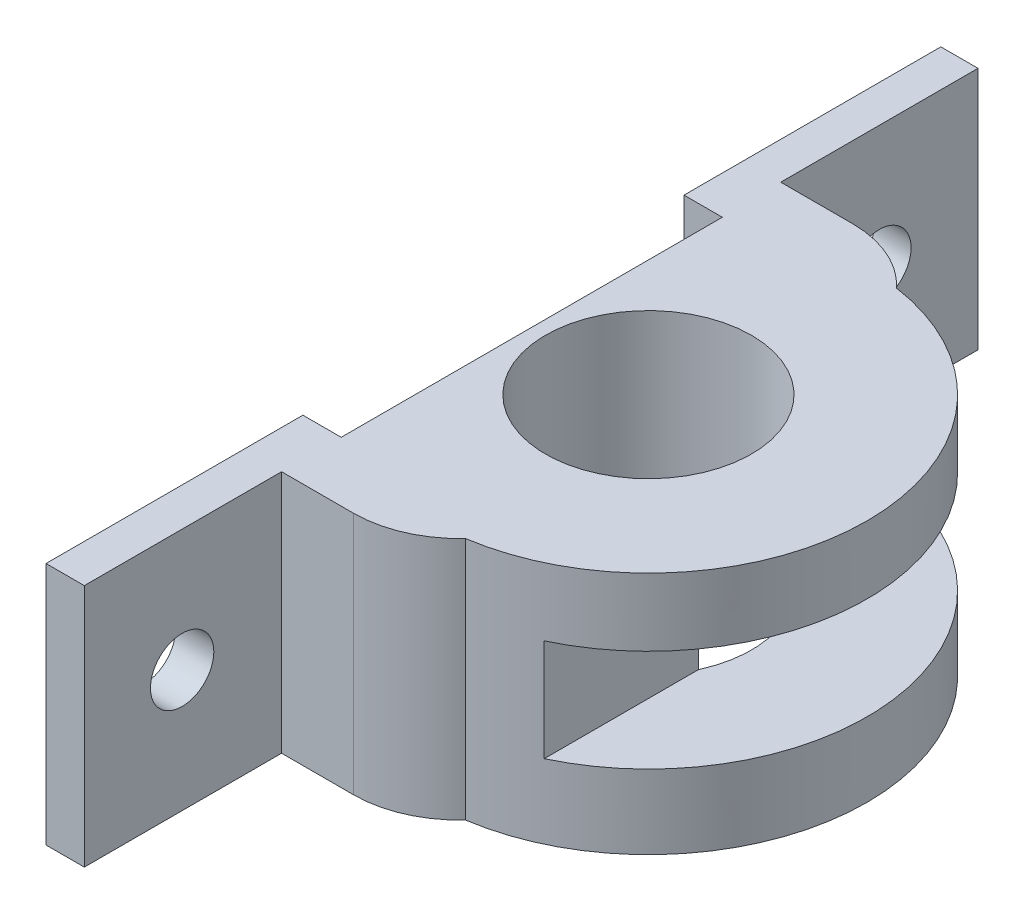
from build123d import *

# Parameters (mm, degrees)
SKETCH_1_R           = 20.68
SKETCH_1_R_2         = 9.68
EXTRUDE_1_DEPTH      = 116.68
SKETCH_11_W          = 27
SKETCH_11_H          = 150
CUT_EXTRUDE_3_DEPTH  = 40
SKETCH_13_W          = 10
SKETCH_13_H          = 128.345013401
CUT_EXTRUDE_7_DEPTH  = 126.614916312
SKETCH_15_W          = 8
SKETCH_15_H          = 68.68
CUT_EXTRUDE_9_DEPTH  = 48
SKETCH_16_W          = 15.549431524
SKETCH_16_H          = 20
SKETCH_16_W_2        = 15.459431524
EXTRUDE_4_DEPTH      = 19.2
SKETCH_17_W          = 19.20851187
SKETCH_17_H          = 14.03
CUT_EXTRUDE_10_DEPTH = 20.2
SKETCH_18_R          = 9.59
CUT_EXTRUDE_11_DEPTH = 121.289430957
SKETCH_21_R          = 2.985
CUT_EXTRUDE_12_DEPTH = 55.2
EXTRUDE_START        = 55.2
SKETCH_24_R          = 20.59
SKETCH_24_R_2        = 9.59
EXTRUDE_2_DEPTH      = 55.2
CUT_EXTRUDE_13_DEPTH = 55.2
SKETCH_26_W          = 10.00851187
SKETCH_26_H          = 41.68
CUT_EXTRUDE_15_DEPTH = 55.2
SKETCH_27_W          = 10
SKETCH_27_H          = 40
CUT_EXTRUDE_16_DEPTH = 55.2
SKETCH_28_W          = 44.880694938
SKETCH_28_H          = 9.608044066
CUT_EXTRUDE_17_DEPTH = 12.2
SKETCH_35_W          = 13.53
SKETCH_35_H          = 20
EXTRUDE_10_DEPTH     = 15
EXTRUDE_11_DEPTH     = 15
SKETCH_37_W          = 9
SKETCH_37_H          = 20
EXTRUDE_12_DEPTH     = 20
SKETCH_38_W          = 9
SKETCH_38_H          = 20
EXTRUDE_13_DEPTH     = 20
SKETCH_42_R          = 2.985
CUT_EXTRUDE_21_DEPTH = 20
CUT_EXTRUDE_23_DEPTH = 138.235841092
SKETCH_45_W          = 3
SKETCH_45_H          = 20
EXTRUDE_14_DEPTH     = 30
SKETCH_46_W          = 3
SKETCH_46_H          = 20
EXTRUDE_15_DEPTH     = 30
SKETCH_47_W          = 33.078221107
SKETCH_47_H          = 20
EXTRUDE_16_DEPTH     = 50
SKETCH_48_W          = 30
SKETCH_48_H          = 20
EXTRUDE_17_DEPTH     = 50
SKETCH_50_W          = 50
SKETCH_50_H          = 20
EXTRUDE_18_DEPTH     = 1
SKETCH_51_W          = 50
SKETCH_51_H          = 20
EXTRUDE_19_DEPTH     = 1
SKETCH_52_W          = 53
SKETCH_52_H          = 14
CUT_EXTRUDE_24_DEPTH = 151.972575738
SKETCH_53_W          = 53
SKETCH_53_H          = 14
CUT_EXTRUDE_25_DEPTH = 151.942387436
SKETCH_54_W          = 40
SKETCH_54_H          = 73.27
CUT_EXTRUDE_26_DEPTH = 147.866192927
SKETCH_56_W          = 13.00851187
SKETCH_56_H          = 20
EXTRUDE_21_DEPTH     = 3.08
SKETCH_60_W          = 6.504255935
SKETCH_60_H          = 76.35
CUT_EXTRUDE_30_DEPTH = 137.106994034
CUT_EXTRUDE_32_DEPTH = 20
SKETCH_64_W          = 16.20851187
SKETCH_64_H          = 0.09
EXTRUDE_22_DEPTH     = 20
SKETCH_65_W          = 3.495744065
SKETCH_65_H          = 3.26
CUT_EXTRUDE_33_DEPTH = 137.057988464
SKETCH_66_W          = 3.495744065
SKETCH_66_H          = 1.776778893
SKETCH_66_W_2        = 3.503635083
SKETCH_66_H_2        = 1.775
EXTRUDE_23_DEPTH     = 20.2
SKETCH_68_W          = 6.504255935
SKETCH_68_H          = 3.66
CUT_EXTRUDE_34_DEPTH = 20
SKETCH_69_R          = 2.985
CUT_EXTRUDE_35_DEPTH = 126.598983893
SKETCH_70_R          = 2.985
CUT_EXTRUDE_36_DEPTH = 132.360728238
SKETCH_71_W          = 38.005321573
SKETCH_71_H          = 111.965885132
CUT_EXTRUDE_37_DEPTH = 147.475577566
SKETCH_72_R          = 9.7
CUT_EXTRUDE_38_DEPTH = 38.185254838
CUT_EXTRUDE_START    = -22
SKETCH_77_R          = 30.59
SKETCH_77_R_2        = 20.59
CUT_EXTRUDE_2_DEPTH  = 22
SKETCH_78_W          = 34.816185151
SKETCH_78_H          = 22.96559116
EXTRUDE_26_DEPTH     = 0.1
SKETCH_80_W          = 2.900031179
SKETCH_80_H          = 6.148706656
EXTRUDE_28_DEPTH     = 23.1
SKETCH_81_W          = 6.148706656
SKETCH_81_H          = 23.1
EXTRUDE_29_DEPTH     = 14.1
SKETCH_82_W          = 6.148706656
SKETCH_82_H          = 0.13440884
CUT_EXTRUDE_39_DEPTH = 19.1
SKETCH_83_W          = 2.900031179
SKETCH_83_H          = 22.96559116
EXTRUDE_30_DEPTH     = 19.1
FILLET_1_R           = 10
SKETCH_84_W          = 3.5
SKETCH_84_H          = 19.1
EXTRUDE_31_DEPTH     = 23.1
SKETCH_85_W          = 3.5
SKETCH_85_H          = 0.52
CUT_EXTRUDE_40_DEPTH = 48.860163141
SKETCH_86_W          = 3.5
SKETCH_86_H          = 22.96559116
EXTRUDE_32_DEPTH     = 62.1
SKETCH_87_W          = 3.60851187
SKETCH_87_H          = 34.816185151
CUT_EXTRUDE_41_DEPTH = 62.1
SKETCH_89_W          = 0.10851187
SKETCH_89_H          = 6.15
EXTRUDE_33_DEPTH     = 23.1
EXTRUDE_34_DEPTH     = 22.1
SKETCH_91_W          = 0.971561636
SKETCH_91_H          = 22.96559116
CUT_EXTRUDE_42_DEPTH = 22.1
SKETCH_95_W          = 6.15
SKETCH_95_H          = 22.96559116
EXTRUDE_35_DEPTH     = 14.1
FILLET_2_R           = 10
SKETCH_96_W          = 3.60851187
SKETCH_96_H          = 2.548438364
CUT_EXTRUDE_43_DEPTH = 55.35700885
SKETCH_97_W          = 3.5
SKETCH_97_H          = 6.148706656
EXTRUDE_36_DEPTH     = 23.1
CUT_EXTRUDE_44_DEPTH = 23.1
SKETCH_99_W          = 6.15
SKETCH_99_H          = 0.13440884
CUT_EXTRUDE_45_DEPTH = 23.1
SKETCH_101_R         = 2.985
CUT_EXTRUDE_46_DEPTH = 23.1
SKETCH_103_W         = 3.60851187
SKETCH_103_H         = 0.54
CUT_EXTRUDE_49_DEPTH = 53.222714265
SKETCH_104_W         = 3.60851187
SKETCH_104_H         = 0.54
CUT_EXTRUDE_50_DEPTH = 53.222714265


with BuildPart() as part:
    # 草圖1 → 伸長-薄件1 (new body)
    with BuildSketch(Plane(origin=(0, 0, 0), x_dir=(1, 0, 0), z_dir=(0, 1, 0))):
        Circle(SKETCH_1_R)
        Circle(SKETCH_1_R_2, mode=Mode.SUBTRACT)
    extrude(amount=EXTRUDE_1_DEPTH)

    # 草圖11 → 除料-伸長3 (cut)
    with BuildSketch(Plane(origin=(0, 116.68, 0), x_dir=(1, 0, 0), z_dir=(0, 1, 0))):
        with Locations((21.70851187, -44.235815192)):
            Rectangle(SKETCH_11_W, SKETCH_11_H)
    extrude(amount=-CUT_EXTRUDE_3_DEPTH, mode=Mode.SUBTRACT)

    # 草圖13 → 除料-伸長7 (cut, through all)
    with BuildSketch(Plane.XY.offset(21)):
        with Locations((-16, 58.612182466)):
            Rectangle(SKETCH_13_W, SKETCH_13_H)
    extrude(amount=-CUT_EXTRUDE_7_DEPTH, mode=Mode.SUBTRACT)

    # 草圖15 → 除料-伸長9 (cut)
    with BuildSketch(Plane.XY.offset(21)):
        with Locations((-1.395744065, 52.34)):
            Rectangle(SKETCH_15_W, SKETCH_15_H)
    extrude(amount=-CUT_EXTRUDE_9_DEPTH, mode=Mode.SUBTRACT)

    # 草圖16 → 填料-伸長4 (add)
    with BuildSketch(Plane(origin=(8.20851187, 0, 0), x_dir=(0, 0, -1), z_dir=(1, 0, 0))):
        with Locations((12.905284238, 106.68)):
            Rectangle(SKETCH_16_W, SKETCH_16_H)
        with Locations((-12.860284238, 106.68)):
            Rectangle(SKETCH_16_W_2, SKETCH_16_H)
    extrude(amount=-EXTRUDE_4_DEPTH)

    # 草圖17 → 除料-伸長10 (cut)
    with BuildSketch(Plane(origin=(0, 116.68, 0), x_dir=(1, 0, 0), z_dir=(0, 1, 0))):
        with Locations((-1.395744065, -0.045)):
            Rectangle(SKETCH_17_W, SKETCH_17_H)
    extrude(amount=-CUT_EXTRUDE_10_DEPTH, mode=Mode.SUBTRACT)

    # 草圖18 → 除料-伸長11 (cut, through all)
    with BuildSketch(Plane.XZ):
        with Locations(Location((0, 0, 0), (0, 0, 90))):
            Circle(SKETCH_18_R)
    extrude(amount=-CUT_EXTRUDE_11_DEPTH, mode=Mode.SUBTRACT)

    # 草圖21 → 除料-伸長12 (cut)
    with BuildSketch(Plane(origin=(0, 0, -20.68), x_dir=(-1, 0, 0), z_dir=(0, 0, -1))):
        with Locations((1.39148813, 108.73)):
            Circle(SKETCH_21_R)
    extrude(amount=-CUT_EXTRUDE_12_DEPTH, mode=Mode.SUBTRACT)

    # 草圖24 → 伸長-薄件2 (add)
    with BuildSketch(Plane.XZ.offset(EXTRUDE_START)):
        Circle(SKETCH_24_R)
        Circle(SKETCH_24_R_2, mode=Mode.SUBTRACT)
    extrude(amount=-EXTRUDE_2_DEPTH)

    # 草圖25 → 除料-伸長13 (cut)
    with BuildSketch(Plane.XY.offset(21)):
        Polygon((-1.39148813, -11.785), (22.612379708, -11.785), (22.612379708, -63.873337429), (-22.749525245, -63.873337429), (-22.749525245, -11.785), align=None)
    extrude(amount=-CUT_EXTRUDE_13_DEPTH, mode=Mode.SUBTRACT)

    # 草圖26 → 除料-伸長15 (cut)
    with BuildSketch(Plane(origin=(0, 0, 0), x_dir=(1, 0, 0), z_dir=(0, 1, 0))):
        with Locations((-15.995744065, -0.16)):
            Rectangle(SKETCH_26_W, SKETCH_26_H)
    extrude(amount=-CUT_EXTRUDE_15_DEPTH, mode=Mode.SUBTRACT)

    # 草圖27 → 除料-伸長16 (cut)
    with BuildSketch(Plane(origin=(21, 0, 0), x_dir=(0, 0, -1), z_dir=(1, 0, 0))):
        with Locations((0, 41.68)):
            Rectangle(SKETCH_27_W, SKETCH_27_H)
    extrude(amount=-CUT_EXTRUDE_16_DEPTH, mode=Mode.SUBTRACT)

    # 草圖28 → 除料-伸長17 (cut)
    with BuildSketch(Plane(origin=(21, 0, 0), x_dir=(0, 0, -1), z_dir=(1, 0, 0))):
        Rectangle(SKETCH_28_W, SKETCH_28_H)
    extrude(amount=-CUT_EXTRUDE_17_DEPTH, mode=Mode.SUBTRACT)

    # 草圖35 → 填料-伸長10 (add)
    with BuildSketch(Plane.ZY.offset(10.99148813)):
        with Locations((13.825, 106.68)):
            Rectangle(SKETCH_35_W, SKETCH_35_H)
    extrude(amount=EXTRUDE_10_DEPTH)

    # 草圖36 → 填料-伸長11 (add)
    with BuildSketch(Plane.ZY.offset(10.99148813)):
        Polygon((-20.68, 116.68), (-6.97, 116.68), (-6.97, 96.48), (-20.68, 96.68), align=None)
    extrude(amount=EXTRUDE_11_DEPTH)

    # 草圖37 → 填料-伸長12 (add)
    with BuildSketch(Plane.XY.offset(20.59)):
        with Locations((-21.49148813, 106.68)):
            Rectangle(SKETCH_37_W, SKETCH_37_H)
    extrude(amount=EXTRUDE_12_DEPTH)

    # 草圖38 → 填料-伸長13 (add)
    with BuildSketch(Plane(origin=(0, 0, -20.68), x_dir=(-1, 0, 0), z_dir=(0, 0, -1))):
        with Locations((21.49148813, 106.68)):
            Rectangle(SKETCH_38_W, SKETCH_38_H)
    extrude(amount=EXTRUDE_13_DEPTH)

    # 草圖42 → 除料-伸長21 (cut)
    with BuildSketch(Plane(origin=(-16.99148813, 0, 0), x_dir=(0, 0, -1), z_dir=(1, 0, 0))):
        with Locations((30.68, 106.554418142)):
            Circle(SKETCH_42_R)
        with Locations((-30.395640125, 106.68)):
            Circle(SKETCH_42_R)
    extrude(amount=-CUT_EXTRUDE_21_DEPTH, mode=Mode.SUBTRACT)

    # 草圖43 → 除料-伸長23 (cut, through all)
    with BuildSketch(Plane(origin=(0, 116.68, 0), x_dir=(1, 0, 0), z_dir=(0, 1, 0))):
        Polygon((-11, 6.97), (-10.99148813, 20.68), (-10.99148813, 48.096794253), (-28.274756234, 48.096794253), (-28.274756234, -43.270506289), (-11, -43.270506289), align=None)
    extrude(amount=-CUT_EXTRUDE_23_DEPTH, mode=Mode.SUBTRACT)

    # 草圖45 → 填料-伸長14 (add)
    with BuildSketch(Plane.XY.offset(20.59)):
        with Locations((-9.5, 106.68)):
            Rectangle(SKETCH_45_W, SKETCH_45_H)
    extrude(amount=EXTRUDE_14_DEPTH)

    # 草圖46 → 填料-伸長15 (add)
    with BuildSketch(Plane(origin=(0, 0, -20.68), x_dir=(-1, 0, 0), z_dir=(0, 0, -1))):
        with Locations((9.49148813, 106.68)):
            Rectangle(SKETCH_46_W, SKETCH_46_H)
    extrude(amount=EXTRUDE_15_DEPTH)

    # 草圖47 → 填料-伸長16 (add)
    with BuildSketch(Plane.ZY.offset(11)):
        with Locations((34.050889447, 106.68)):
            Rectangle(SKETCH_47_W, SKETCH_47_H)
    extrude(amount=EXTRUDE_16_DEPTH)

    # 草圖48 → 填料-伸長17 (add)
    with BuildSketch(Plane.ZY.offset(10.99148813)):
        with Locations((-35.68, 106.68)):
            Rectangle(SKETCH_48_W, SKETCH_48_H)
    extrude(amount=EXTRUDE_17_DEPTH)

    # 草圖50 → 填料-伸長18 (add)
    with BuildSketch(Plane(origin=(0, 0, 17.511778893), x_dir=(-1, 0, 0), z_dir=(0, 0, -1))):
        with Locations((36, 106.68)):
            Rectangle(SKETCH_50_W, SKETCH_50_H)
    extrude(amount=EXTRUDE_18_DEPTH)

    # 草圖51 → 填料-伸長19 (add)
    with BuildSketch(Plane.XY.offset(-20.68)):
        with Locations((-35.99148813, 106.68)):
            Rectangle(SKETCH_51_W, SKETCH_51_H)
    extrude(amount=EXTRUDE_19_DEPTH)

    # 草圖52 → 除料-伸長24 (cut, through all)
    with BuildSketch(Plane(origin=(0, 116.68, 0), x_dir=(1, 0, 0), z_dir=(0, 1, 0))):
        with Locations((-34.49148813, 43.68)):
            Rectangle(SKETCH_52_W, SKETCH_52_H)
    extrude(amount=-CUT_EXTRUDE_24_DEPTH, mode=Mode.SUBTRACT)

    # 草圖53 → 除料-伸長25 (cut, through all)
    with BuildSketch(Plane(origin=(0, 116.68, 0), x_dir=(1, 0, 0), z_dir=(0, 1, 0))):
        with Locations((-34.5, -43.59)):
            Rectangle(SKETCH_53_W, SKETCH_53_H)
    extrude(amount=-CUT_EXTRUDE_25_DEPTH, mode=Mode.SUBTRACT)

    # 草圖54 → 除料-伸長26 (cut, through all)
    with BuildSketch(Plane(origin=(0, 116.68, 0), x_dir=(1, 0, 0), z_dir=(0, 1, 0))):
        with Locations((-41, 0.045)):
            Rectangle(SKETCH_54_W, SKETCH_54_H)
    extrude(amount=-CUT_EXTRUDE_26_DEPTH, mode=Mode.SUBTRACT)

    # 草圖56 → 填料-伸長21 (add)
    with BuildSketch(Plane(origin=(0, 0, -36.68), x_dir=(-1, 0, 0), z_dir=(0, 0, -1))):
        with Locations((14.495744065, 106.68)):
            Rectangle(SKETCH_56_W, SKETCH_56_H)
    extrude(amount=EXTRUDE_21_DEPTH)

    # 草圖60 → 除料-伸長30 (cut, through all)
    with BuildSketch(Plane(origin=(0, 116.68, 0), x_dir=(1, 0, 0), z_dir=(0, 1, 0))):
        with Locations((-17.747872032, 1.585)):
            Rectangle(SKETCH_60_W, SKETCH_60_H)
    extrude(amount=-CUT_EXTRUDE_30_DEPTH, mode=Mode.SUBTRACT)

    # 草圖61 → 除料-伸長32 (cut)
    with BuildSketch(Plane(origin=(0, 116.68, 0), x_dir=(1, 0, 0), z_dir=(0, 1, 0))):
        Polygon((1.92725193, -20.59), (1.92725193, -22.399121663), (-2.174190472, -21.421542421), (-2.174190472, -20.59), align=None)
    extrude(amount=-CUT_EXTRUDE_32_DEPTH, mode=Mode.SUBTRACT)

    # 草圖64 → 填料-伸長22 (add)
    with BuildSketch(Plane(origin=(0, 116.68, 0), x_dir=(1, 0, 0), z_dir=(0, 1, 0))):
        with Locations((0.104255935, -20.635)):
            Rectangle(SKETCH_64_W, SKETCH_64_H)
    extrude(amount=-EXTRUDE_22_DEPTH)

    # 草圖65 → 除料-伸長33 (cut, through all)
    with BuildSketch(Plane(origin=(0, 116.68, 0), x_dir=(1, 0, 0), z_dir=(0, 1, 0))):
        with Locations((-12.747872033, -18.141778893)):
            Rectangle(SKETCH_65_W, SKETCH_65_H)
    extrude(amount=-CUT_EXTRUDE_33_DEPTH, mode=Mode.SUBTRACT)

    # 草圖66 → 填料-伸長23 (add)
    with BuildSketch(Plane(origin=(0, 96.48, 0), x_dir=(1, 0, 0), z_dir=(0, 1, 0))):
        with Locations((-12.747872033, -18.883389447)):
            Rectangle(SKETCH_66_W, SKETCH_66_H)
        with Locations((-12.743926524, 18.7925)):
            Rectangle(SKETCH_66_W_2, SKETCH_66_H_2)
    extrude(amount=EXTRUDE_23_DEPTH)

    # 草圖68 → 除料-伸長34 (cut)
    with BuildSketch(Plane(origin=(0, 116.68, 0), x_dir=(1, 0, 0), z_dir=(0, 1, 0))):
        with Locations((-11.243616098, 37.93)):
            Rectangle(SKETCH_68_W, SKETCH_68_H)
    extrude(amount=-CUT_EXTRUDE_34_DEPTH, mode=Mode.SUBTRACT)

    # 草圖69 → 除料-伸長35 (cut, through all)
    with BuildSketch(Plane(origin=(-7.99148813, 0, 0), x_dir=(0, 0, -1), z_dir=(1, 0, 0))):
        with Locations((28.39, 106.68)):
            Circle(SKETCH_69_R)
        with Locations((-28.635, 106.68)):
            Circle(SKETCH_69_R)
    extrude(amount=-CUT_EXTRUDE_35_DEPTH, mode=Mode.SUBTRACT)

    # 草圖70 → 除料-伸長36 (cut, through all)
    with BuildSketch(Plane(origin=(0, 0, 20.59), x_dir=(-1, 0, 0), z_dir=(0, 0, -1))):
        with Locations((1.39148813, 108.73)):
            Circle(SKETCH_70_R)
    extrude(amount=-CUT_EXTRUDE_36_DEPTH, mode=Mode.SUBTRACT)

    # 草圖71 → 除料-伸長37 (cut, through all)
    with BuildSketch(Plane.XY.offset(50)):
        with Locations((2.76131712, 67.163533726)):
            Rectangle(SKETCH_71_W, SKETCH_71_H)
    extrude(amount=-CUT_EXTRUDE_37_DEPTH, mode=Mode.SUBTRACT)

    # 草圖72 → 除料-伸長38 (cut, through all)
    with BuildSketch(Plane.XZ.offset(11.785)):
        with Locations(Location((0, 0, 0), (0, 0, 270))):
            Circle(SKETCH_72_R)
    extrude(amount=-CUT_EXTRUDE_38_DEPTH, mode=Mode.SUBTRACT)

    # 草圖77 → 除料-伸長-薄件2 (cut)
    with BuildSketch(Plane(origin=(0, 11.18059116, 0), x_dir=(1, 0, 0), z_dir=(0, 1, 0)).offset(CUT_EXTRUDE_START)):
        Circle(SKETCH_77_R)
        Circle(SKETCH_77_R_2, mode=Mode.SUBTRACT)
    extrude(amount=CUT_EXTRUDE_2_DEPTH, mode=Mode.SUBTRACT)

    # 草圖78 → 填料-伸長26 (add)
    with BuildSketch(Plane.ZY.offset(11)):
        with Locations((-0.002688243, -0.30220442)):
            Rectangle(SKETCH_78_W, SKETCH_78_H)
    extrude(amount=EXTRUDE_26_DEPTH)



with BuildPart() as body_2:
    # 草圖80 → 填料-伸長28 (new body)
    with BuildSketch(Plane.XZ.offset(11.785)):
        with Locations((-12.55001559, -20.485134146)):
            Rectangle(SKETCH_80_W, SKETCH_80_H)
    extrude(amount=-EXTRUDE_28_DEPTH)


with BuildPart() as part_1:
    add(part.part)

    add(body_2.part)  # 填料-伸長29 merges body 2
    # 草圖81 → 填料-伸長29 (add)
    with BuildSketch(Plane(origin=(-11.1, 0, 0), x_dir=(0, 0, -1), z_dir=(1, 0, 0))):
        with Locations((20.485134146, -0.235)):
            Rectangle(SKETCH_81_W, SKETCH_81_H)
    extrude(amount=EXTRUDE_29_DEPTH)

    # 草圖82 → 除料-伸長39 (cut)
    with BuildSketch(Plane(origin=(3, 0, 0), x_dir=(0, 0, -1), z_dir=(1, 0, 0))):
        with Locations((20.485134146, 11.24779558)):
            Rectangle(SKETCH_82_W, SKETCH_82_H)
    extrude(amount=-CUT_EXTRUDE_39_DEPTH, mode=Mode.SUBTRACT)

    # 草圖83 → 填料-伸長30 (add)
    with BuildSketch(Plane.XY.offset(-17.410780818)):
        with Locations((-12.55001559, -0.30220442)):
            Rectangle(SKETCH_83_W, SKETCH_83_H)
    extrude(amount=-EXTRUDE_30_DEPTH)

    # 圓角1
    # the kernel refuses this fillet: 10 mm, written as the material it takes off along each edge
    with BuildSketch(Plane(origin=(3, -30.090254449, -23.559487474), x_dir=(-1, 0, 0), z_dir=(0, 1, 0))) as fillet_1_piece_1:
        with BuildLine():
            CenterArc((7.32210178, 10), FILLET_1_R, 222.927997508, 47.072002492)
            Line((0, 3.189212562), (-0.146442036, 3.052996813))
            ThreePointArc((-0.146442036, 3.052996813), (-0.2, 1.594606281), (-0.2, 0))
            Line((-0.2, 0), (0, -0.2))
            Line((0, -0.2), (7.32210178, -0.2))
            Line((7.32210178, -0.2), (7.32210178, 0))
        make_face()
    extrude(amount=59.576100059, mode=Mode.SUBTRACT)

    # 草圖84 → 填料-伸長31 (add)
    with BuildSketch(Plane(origin=(0, -11.785, 0), x_dir=(-1, 0, 0), z_dir=(0, -1, 0))):
        with Locations((12.85, 26.960780818)):
            Rectangle(SKETCH_84_W, SKETCH_84_H)
    extrude(amount=-EXTRUDE_31_DEPTH)

    # 草圖85 → 除料-伸長40 (cut, through all)
    with BuildSketch(Plane.XZ.offset(11.785)):
        with Locations((-12.85, -36.250780818)):
            Rectangle(SKETCH_85_W, SKETCH_85_H)
    extrude(amount=-CUT_EXTRUDE_40_DEPTH, mode=Mode.SUBTRACT)

    # 草圖86 → 填料-伸長32 (add)
    with BuildSketch(Plane.XY.offset(-17.410780818)):
        with Locations((-12.85, -0.30220442)):
            Rectangle(SKETCH_86_W, SKETCH_86_H)
    extrude(amount=EXTRUDE_32_DEPTH)

    # 草圖87 → 除料-伸長41 (cut)
    with BuildSketch(Plane.XZ.offset(11.785)):
        with Locations((-12.795744065, -0.002688243)):
            Rectangle(SKETCH_87_W, SKETCH_87_H)
    extrude(amount=-CUT_EXTRUDE_41_DEPTH, mode=Mode.SUBTRACT)


with BuildPart() as cut_extrude_41_piece_1:
    # of the separate pieces the step leaves, piece 1, a body of its own (cut_extrude_41_pieces)
    add(part_1.part.solids().sort_by_distance((3, 11.18059116, -20.370274912))[0])



with BuildPart() as cut_extrude_41_piece_2:
    # of the separate pieces the step leaves, piece 2, a body of its own (cut_extrude_41_pieces)
    add(part_1.part.solids().sort_by_distance((-11.1, 11.18059116, 17.405404333))[0])

    # 草圖89 → 填料-伸長33 (add)
    with BuildSketch(Plane.XZ.offset(11.785)):
        with Locations((-11.045744065, 20.485780818)):
            Rectangle(SKETCH_89_W, SKETCH_89_H)
    extrude(amount=-EXTRUDE_33_DEPTH)

    # 草圖90 → 填料-伸長34 (add)
    with BuildSketch(Plane.XY.offset(23.560780818)):
        Polygon((-11, 11.18059116), (-11.1, 11.18059116), (-11.1, -11.785), (-10.99148813, -11.785), (-10.99148813, 11.18059116), align=None)
    extrude(amount=EXTRUDE_34_DEPTH)

    # 草圖91 → 除料-伸長42 (cut)
    with BuildSketch(Plane.ZY.offset(11.1)):
        with Locations((45.175, -0.30220442)):
            Rectangle(SKETCH_91_W, SKETCH_91_H)
    extrude(amount=-CUT_EXTRUDE_42_DEPTH, mode=Mode.SUBTRACT)


with BuildPart() as cut_extrude_41_piece_1_1:
    add(cut_extrude_41_piece_1.part)

    add(cut_extrude_41_piece_2.part)  # 填料-伸長35 merges 除料-伸長41 piece 2
    # 草圖95 → 填料-伸長35 (add)
    with BuildSketch(Plane(origin=(-10.99148813, 0, 0), x_dir=(0, 0, -1), z_dir=(1, 0, 0))):
        with Locations((-20.485780818, -0.30220442)):
            Rectangle(SKETCH_95_W, SKETCH_95_H)
    extrude(amount=EXTRUDE_35_DEPTH)

    # 圓角2
    # the kernel refuses this fillet: 10 mm, written as the material it takes off along each edge
    with BuildSketch(Plane(origin=(3.10851187, -30.131013506, 23.560780818), x_dir=(-1, 0, 0), z_dir=(0, 1, 0))) as fillet_2_piece_1:
        with BuildLine():
            CenterArc((7.338405402, -10), FILLET_2_R, 90, 47.209333859)
            Line((0, -3.206782342), (-0.146768108, -3.070917989))
            ThreePointArc((-0.146768108, -3.070917989), (-0.2, -1.603391171), (-0.2, 0))
            Line((-0.2, 0), (0, 0.2))
            Line((0, 0.2), (7.338405402, 0.2))
            Line((7.338405402, 0.2), (7.338405402, 0))
        make_face()
    extrude(amount=59.657618171, mode=Mode.SUBTRACT)

    # 草圖96 → 除料-伸長43 (cut, through all)
    with BuildSketch(Plane.XZ.offset(11.785)):
        with Locations((-12.795744065, 43.415)):
            Rectangle(SKETCH_96_W, SKETCH_96_H)
    extrude(amount=-CUT_EXTRUDE_43_DEPTH, mode=Mode.SUBTRACT)

    # 草圖97 → 填料-伸長36 (add)
    with BuildSketch(Plane.XZ.offset(11.785)):
        with Locations((-12.85, -39.065134146)):
            Rectangle(SKETCH_97_W, SKETCH_97_H)
    extrude(amount=-EXTRUDE_36_DEPTH)

    # 草圖98 → 除料-伸長44 (cut)
    with BuildSketch(Plane(origin=(-11.1, 0, 0), x_dir=(0, 0, -1), z_dir=(1, 0, 0))):
        Polygon((17.410780818, 11.18059116), (17.410780818, 11.315), (22.198280677, 11.315), (38.461669752, 11.315), (42.139487474, 11.315), (42.139487474, 11.18059116), align=None)
    extrude(amount=-CUT_EXTRUDE_44_DEPTH, mode=Mode.SUBTRACT)

    # 草圖99 → 除料-伸長45 (cut)
    with BuildSketch(Plane(origin=(-10.99148813, 0, 0), x_dir=(0, 0, -1), z_dir=(1, 0, 0))):
        with Locations((-20.485780818, 11.24779558)):
            Rectangle(SKETCH_99_W, SKETCH_99_H)
    extrude(amount=-CUT_EXTRUDE_45_DEPTH, mode=Mode.SUBTRACT)

    # 草圖101 → 除料-伸長46 (cut)
    with BuildSketch(Plane(origin=(-10.99148813, 0, 0), x_dir=(0, 0, -1), z_dir=(1, 0, 0))):
        with Locations((-32.928668636, -0.30220442)):
            Circle(SKETCH_101_R)
        with Locations((32.849487474, -0.30220442)):
            Circle(SKETCH_101_R)
    extrude(amount=-CUT_EXTRUDE_46_DEPTH, mode=Mode.SUBTRACT)

    # 草圖103 → 除料-伸長49 (cut, through all)
    with BuildSketch(Plane(origin=(0, 11.18059116, 0), x_dir=(1, 0, 0), z_dir=(0, 1, 0))):
        with Locations((-12.795744065, -17.675404333)):
            Rectangle(SKETCH_103_W, SKETCH_103_H)
    extrude(amount=-CUT_EXTRUDE_49_DEPTH, mode=Mode.SUBTRACT)

    # 草圖104 → 除料-伸長50 (cut, through all)
    with BuildSketch(Plane(origin=(0, 11.18059116, 0), x_dir=(1, 0, 0), z_dir=(0, 1, 0))):
        with Locations((-12.795744065, 17.680780818)):
            Rectangle(SKETCH_104_W, SKETCH_104_H)
    extrude(amount=-CUT_EXTRUDE_50_DEPTH, mode=Mode.SUBTRACT)


solid = cut_extrude_41_piece_1_1.part
